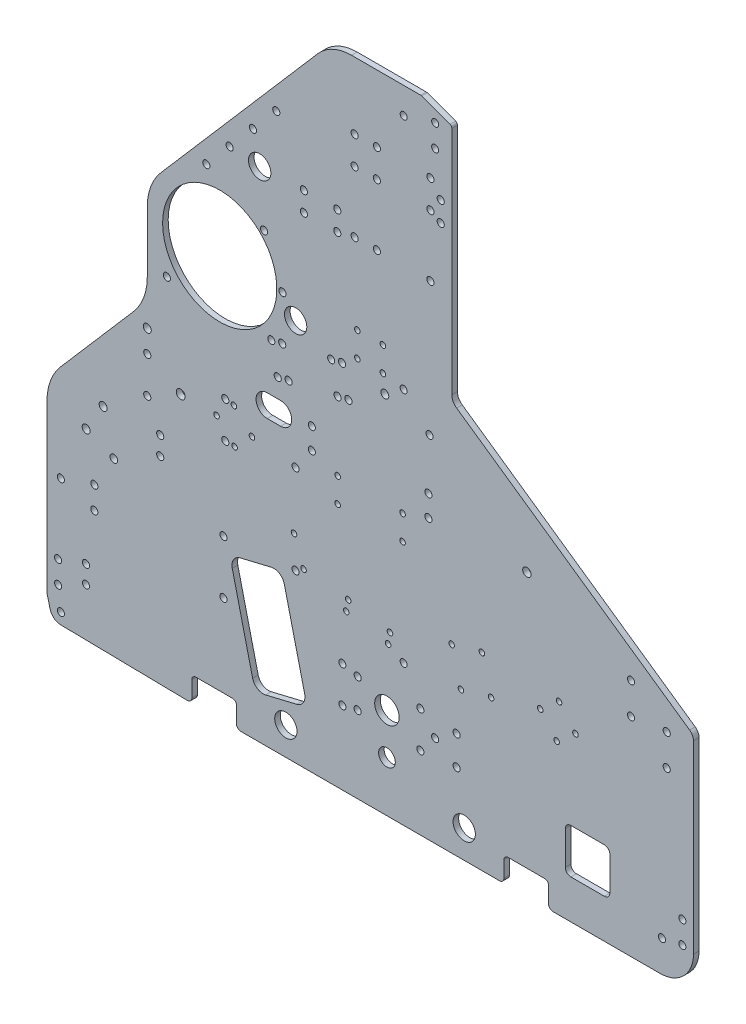
from build123d import *

# Parameters (mm, degrees)
SKETCH1_R           = 2.032
SKETCH1_R_2         = 2.54
SKETCH1_R_3         = 2
BOSS_EXTRUDE1_DEPTH = 3.175
FILLET1_R           = 2.286
FILLET2_R           = 6.35
SKETCH2_R           = 2.032
CUT_EXTRUDE1_DEPTH  = 505.524983177
FILLET3_R           = 1.5875
SKETCH3_R           = 6.35
SKETCH3_R_2         = 2.032
SKETCH3_R_3         = 2.286
CUT_EXTRUDE2_DEPTH  = 505.524983177
SKETCH4_R           = 2.032
SKETCH4_R_2         = 6.985
SKETCH4_R_3         = 4.7625
CUT_EXTRUDE3_DEPTH  = 505.524983177
SKETCH5_R           = 32.54375
SKETCH5_R_2         = 6.35
SKETCH5_R_3         = 2.39
CUT_EXTRUDE5_DEPTH  = 505.524983177
FILLET4_R           = 31.75
CUT_EXTRUDE6_DEPTH  = 505.524983177
FILLET5_R           = 25.4
SKETCH8_R           = 2.032000002
SKETCH8_R_2         = 2.031999999
SKETCH8_R_3         = 2.031999998
CUT_EXTRUDE7_DEPTH  = 505.524983177
SKETCH10_R          = 2.032000004
CUT_EXTRUDE8_DEPTH  = 505.524983177
SKETCH11_RX         = 2.032
SKETCH11_RY         = 2.031999502
CUT_EXTRUDE9_DEPTH  = 505.524983177
SKETCH12_R          = 2.032
CUT_EXTRUDE10_DEPTH = 505.524983319
SKETCH14_R          = 6.375981846
CUT_EXTRUDE11_DEPTH = 505.524983319
SKETCH15_R          = 2.286
SKETCH15_R_2        = 2.159
CUT_EXTRUDE12_DEPTH = 505.524983319
FILLET7_R           = 5.08
FILLET8_R           = 2.54
SKETCH17_R          = 2.032
CUT_EXTRUDE13_DEPTH = 505.524983319
FILLET9_R           = 19.05
SKETCH18_R          = 1.5875
CUT_EXTRUDE14_DEPTH = 505.524983319


with BuildPart() as part:
    # Sketch1 → Boss-Extrude1 (new body)
    with BuildSketch(Plane.XY):
        with BuildLine():
            Line((7.829508682, -19.049081656), (82.55, -20.32))
            Line((82.55, -20.32), (82.55, -6.35))
            Line((82.55, -6.35), (107.95, -6.35))
            Line((107.95, -6.35), (107.95, -20.32))
            Line((107.95, -20.32), (260.35, -20.32))
            Line((260.35, -20.32), (260.35, -6.35))
            Line((260.35, -6.35), (285.75, -6.35))
            Line((285.75, -6.35), (285.75, -20.32))
            Line((285.75, -20.32), (368.3, -20.32))
            Line((368.3, -20.32), (368.3, 106.68))
            Line((368.3, 106.68), (230.66375, 202.565))
            Line((230.66375, 202.565), (230.66375, 338.455))
            Line((230.66375, 338.455), (213.19998, 344.805))
            Line((213.19998, 344.805), (203.2, 344.805))
            Line((203.2, 344.805), (161.925, 344.805))
            Line((161.925, 344.805), (52.720122664, 218.469945827))
            ThreePointArc((52.720122664, 218.469945827), (52.803835479, 218.142145922), (52.832, 217.805))
            ThreePointArc((52.832, 217.805), (52.095493096, 216.239521914), (50.419872403, 215.808871996))
            Line((50.419872403, 215.808871996), (0, 157.48))
            Line((0, 157.48), (0, 0))
            Line((0, 0), (0, -6.35))
            ThreePointArc((0, -6.35), (0.047577015, -7.125863724), (0.189595124, -7.890101219))
            Line((0.189595124, -7.890101219), (1.777095124, -14.240101219))
            ThreePointArc((1.777095124, -14.240101219), (3.987212552, -17.671692778), (7.829508682, -19.049081656))
        make_face()
        with Locations((7.9375, -12.7)):
            Circle(SKETCH1_R, mode=Mode.SUBTRACT)
        with Locations((6.35, 0)):
            Circle(SKETCH1_R, mode=Mode.SUBTRACT)
        with Locations((6.35, 12.7)):
            Circle(SKETCH1_R, mode=Mode.SUBTRACT)
        with Locations((38.1, 78.105)):
            Circle(SKETCH1_R, mode=Mode.SUBTRACT)
        with Locations((57.15, 118.58625)):
            Circle(SKETCH1_R, mode=Mode.SUBTRACT)
        with Locations((57.15, 139.22375)):
            Circle(SKETCH1_R, mode=Mode.SUBTRACT)
        with Locations((76.2, 128.905)):
            Circle(SKETCH1_R_2, mode=Mode.SUBTRACT)
        with Locations((101.6, 118.58625)):
            Circle(SKETCH1_R, mode=Mode.SUBTRACT)
        with Locations((101.6, 139.22375)):
            Circle(SKETCH1_R, mode=Mode.SUBTRACT)
        with BuildLine():
            ThreePointArc((125.468192568, 141.56106164), (119.118192568, 147.91106164), (125.468192568, 154.26106164))
            Line((125.468192568, 154.26106164), (133.088192568, 154.26106164))
            ThreePointArc((133.088192568, 154.26106164), (139.438192568, 147.91106164), (133.088192568, 141.56106164))
            Line((133.088192568, 141.56106164), (125.468192568, 141.56106164))
        make_face(mode=Mode.SUBTRACT)
        with Locations((203.2, 59.805)):
            Circle(SKETCH1_R_3, mode=Mode.SUBTRACT)
        with Locations((350.339487758, -2.359487758)):
            Circle(SKETCH1_R, mode=Mode.SUBTRACT)
        with Locations((361.95, 0)):
            Circle(SKETCH1_R, mode=Mode.SUBTRACT)
        with Locations((361.95, 12.7)):
            Circle(SKETCH1_R, mode=Mode.SUBTRACT)
        with Locations((353.06, 82.955052336)):
            Circle(SKETCH1_R, mode=Mode.SUBTRACT)
        with Locations((332.74, 98.195052336)):
            Circle(SKETCH1_R, mode=Mode.SUBTRACT)
        with Locations((332.74, 115.975052336)):
            Circle(SKETCH1_R, mode=Mode.SUBTRACT)
        with Locations((353.06, 100.735052336)):
            Circle(SKETCH1_R, mode=Mode.SUBTRACT)
        with Locations((68.326, 182.923674932)):
            Circle(SKETCH1_R, mode=Mode.SUBTRACT)
        with Locations((76.2, 217.805)):
            Circle(SKETCH1_R, mode=Mode.SUBTRACT)
        with Locations((90.779500502, 249.682)):
            Circle(SKETCH1_R, mode=Mode.SUBTRACT)
        with Locations((104.067838673, 265.054783374)):
            Circle(SKETCH1_R, mode=Mode.SUBTRACT)
        with Locations((117.356176844, 280.427566748)):
            Circle(SKETCH1_R, mode=Mode.SUBTRACT)
        with Locations((130.644515014, 295.800350122)):
            Circle(SKETCH1_R, mode=Mode.SUBTRACT)
        with Locations((203.2, 194.805)):
            Circle(SKETCH1_R_3, mode=Mode.SUBTRACT)
        with Locations((224.31375, 287.401)):
            Circle(SKETCH1_R, mode=Mode.SUBTRACT)
        with Locations((224.31375, 298.831)):
            Circle(SKETCH1_R, mode=Mode.SUBTRACT)
        with Locations((203.2, 329.805)):
            Circle(SKETCH1_R_3, mode=Mode.SUBTRACT)
        with Locations((221.138115, 322.58)):
            Circle(SKETCH1_R_3, mode=Mode.SUBTRACT)
        with Locations((221.138115, 335.28)):
            Circle(SKETCH1_R_3, mode=Mode.SUBTRACT)
    extrude(amount=BOSS_EXTRUDE1_DEPTH)

    # Fillet1
    fillet1_edges = [part.edges().sort_by_distance(p)[0] for p in [
        (285.75, -6.35, 1.5875),
        (107.95, -6.35, 1.5875),
        (260.35, -6.35, 1.5875),
        (82.55, -6.35, 1.5875),
    ]]
    fillet(fillet1_edges, radius=FILLET1_R)

    # Fillet2
    fillet2_edges = [part.edges().sort_by_distance(p)[0] for p in [
        (230.66375, 202.565, 1.5875),
    ]]
    fillet(fillet2_edges, radius=FILLET2_R)

    # Sketch2 → Cut-Extrude1 (cut, through all)
    with BuildSketch(Plane(origin=(0, 0, 0), x_dir=(-1, 0, 0), z_dir=(0, 0, -1))):
        with Locations((-100.552770272, 71.086035298)):
            Circle(SKETCH2_R)
        with Locations((-100.552770272, 40.606035298)):
            Circle(SKETCH2_R)
        with Locations((-22.225, 18.202541089)):
            Circle(SKETCH2_R)
        with Locations((-22.225, 8.042541089)):
            Circle(SKETCH2_R)
    extrude(amount=-CUT_EXTRUDE1_DEPTH, mode=Mode.SUBTRACT)

    # Fillet3
    fillet3_edges = [part.edges().sort_by_distance(p)[0] for p in [
        (230.66375, 338.455, 1.5875),
        (213.19998, 344.805, 1.5875),
    ]]
    fillet(fillet3_edges, radius=FILLET3_R)

    # Sketch3 → Cut-Extrude2 (cut, through all)
    with BuildSketch(Plane.XY.offset(3.175)):
        with BuildLine():
            Line((127.789350211, 69.359774106), (110.090750339, 65.117184968))
            ThreePointArc((110.090750339, 65.117184968), (106.287939856, 62.356288953), (105.55119507, 57.715047577))
            Line((105.55119507, 57.715047577), (117.160037875, 9.287010566))
            ThreePointArc((117.160037875, 9.287010566), (119.92093389, 5.484200083), (124.562175266, 4.747455297))
            Line((124.562175266, 4.747455297), (142.260775137, 8.990044434))
            ThreePointArc((142.260775137, 8.990044434), (146.063585621, 11.75094045), (146.800330407, 16.392181825))
            Line((146.800330407, 16.392181825), (135.191487602, 64.820218836))
            ThreePointArc((135.191487602, 64.820218836), (132.430591586, 68.62302932), (127.789350211, 69.359774106))
        make_face()
        with Locations((136.094563167, -4.324155877)):
            Circle(SKETCH3_R)
        with Locations((237.694563167, -4.324155877)):
            Circle(SKETCH3_R)
        with Locations((26.987500002, 46.953113935)):
            Circle(SKETCH3_R_2)
        with Locations((26.987500002, 59.653113935)):
            Circle(SKETCH3_R_2)
        with Locations((7.937500002, 53.303113935)):
            Circle(SKETCH3_R_2)
        with Locations((32.030600949, 100.810868853)):
            Circle(SKETCH3_R_3)
        with Locations((64.525942114, 102.94048958)):
            Circle(SKETCH3_R_2)
        with Locations((64.525942114, 92.525786339)):
            Circle(SKETCH3_R_2)
        with Locations((134.14375, 208.228121768)):
            Circle(SKETCH3_R_2)
        with Locations((123.681970341, 233.485092108)):
            Circle(SKETCH3_R_2)
    extrude(amount=-CUT_EXTRUDE2_DEPTH, mode=Mode.SUBTRACT)

    # Sketch4 → Cut-Extrude3 (cut, through all)
    with BuildSketch(Plane.XY.offset(3.175)):
        with Locations((168.275, 42.06875)):
            Circle(SKETCH4_R)
        with Locations((212.725, 42.06875)):
            Circle(SKETCH4_R)
        with Locations((212.725, 21.43125)):
            Circle(SKETCH4_R)
        with Locations((168.275, 21.43125)):
            Circle(SKETCH4_R)
        with Locations((193.675, 31.75)):
            Circle(SKETCH4_R_2)
        with Locations((177.00498, 40.0431)):
            Circle(SKETCH4_R)
        with Locations((177.00498, 23.4569)):
            Circle(SKETCH4_R)
        with Locations((193.675, 8.466666658)):
            Circle(SKETCH4_R_3)
        with Locations((221.138115, 31.75)):
            Circle(SKETCH4_R)
        with Locations((233.36123, 23.4569)):
            Circle(SKETCH4_R)
        with Locations((233.36123, 40.0431)):
            Circle(SKETCH4_R)
    extrude(amount=-CUT_EXTRUDE3_DEPTH, mode=Mode.SUBTRACT)

    # Sketch5 → Cut-Extrude5 (cut, through all)
    with BuildSketch(Plane(origin=(0, 0, 0), x_dir=(-1, 0, 0), z_dir=(0, 0, -1))):
        Polygon((0, 157.48), (-57.15, 223.594705882), (-57.15, 165.333696112), (0, 99.218990229), align=None)
        with Locations((-98.425, 208.228121768)):
            Circle(SKETCH5_R)
        with Locations((-141.675587431, 197.971943782)):
            Circle(SKETCH5_R_2)
        with Locations((-273.4056, 139.72794)):
            Circle(SKETCH5_R_3)
    extrude(amount=-CUT_EXTRUDE5_DEPTH, mode=Mode.SUBTRACT)

    # Fillet4
    fillet4_edges = [part.edges().sort_by_distance(p)[0] for p in [
        (0, 99.218990229, 1.5875),
        (57.15, 165.333696112, 1.5875),
        (57.15, 223.594705882, 1.5875),
    ]]
    fillet(fillet4_edges, radius=FILLET4_R)

    # Sketch6 → Cut-Extrude6 (cut, through all)
    with BuildSketch(Plane.XY.offset(3.175)):
        with BuildLine():
            Line((298.45, 27.305), (317.5, 27.305))
            ThreePointArc((317.5, 27.305), (319.74506403, 26.37506403), (320.675, 24.13))
            Line((320.675, 24.13), (320.675, 5.08))
            ThreePointArc((320.675, 5.08), (319.74506403, 2.83493597), (317.5, 1.905))
            Line((317.5, 1.905), (298.45, 1.905))
            ThreePointArc((298.45, 1.905), (296.20493597, 2.83493597), (295.275, 5.08))
            Line((295.275, 5.08), (295.275, 24.13))
            ThreePointArc((295.275, 24.13), (296.20493597, 26.37506403), (298.45, 27.305))
        make_face()
    extrude(amount=-CUT_EXTRUDE6_DEPTH, mode=Mode.SUBTRACT)

    # Fillet5
    fillet5_edges = [part.edges().sort_by_distance(p)[0] for p in [
        (161.925, 344.805, 1.5875),
    ]]
    fillet(fillet5_edges, radius=FILLET5_R)

    # Sketch8 → Cut-Extrude7 (cut, through all)
    with BuildSketch(Plane(origin=(0, 0, 0), x_dir=(-1, 0, 0), z_dir=(0, 0, -1))):
        with Locations((-218.44, 290.83)):
            Circle(SKETCH8_R)
        with Locations((-187.96, 290.83)):
            Circle(SKETCH8_R)
        with Locations((-187.96, 306.70500001)):
            Circle(SKETCH8_R_2)
        with Locations((-175.26, 290.83)):
            Circle(SKETCH8_R)
        with Locations((-187.96, 255.905)):
            Circle(SKETCH8_R)
        with Locations((-218.44, 306.70500001)):
            Circle(SKETCH8_R_3)
        with Locations((-175.26, 306.70500001)):
            Circle(SKETCH8_R_2)
        with Locations((-175.26, 255.905)):
            Circle(SKETCH8_R)
        with Locations((-218.44, 255.905)):
            Circle(SKETCH8_R)
    extrude(amount=-CUT_EXTRUDE7_DEPTH, mode=Mode.SUBTRACT)

    # Sketch10 → Cut-Extrude8 (cut, through all)
    with BuildSketch(Plane.XY.offset(3.175)):
        with Locations((141.642479994, 74.684371768)):
            Circle(SKETCH10_R)
        with Locations((141.642479994, 125.484371768)):
            Circle(SKETCH10_R)
    extrude(amount=-CUT_EXTRUDE8_DEPTH, mode=Mode.SUBTRACT)

    # Sketch11 → Cut-Extrude9 (cut, through all)
    with BuildSketch(Plane.XY.offset(3.175)):
        with Locations(Location((150.881424454, 138.43), (0, 0, 90))):
            Ellipse(SKETCH11_RX, SKETCH11_RY)
        with Locations(Location((150.881424454, 150.495), (0, 0, 90))):
            Ellipse(SKETCH11_RX, SKETCH11_RY)
        with Locations(Location((217.30240818, 150.495), (0, 0, 90))):
            Ellipse(SKETCH11_RX, SKETCH11_RY)
        with Locations(Location((217.30240818, 138.43), (0, 0, 90))):
            Ellipse(SKETCH11_RX, SKETCH11_RY)
    extrude(amount=-CUT_EXTRUDE9_DEPTH, mode=Mode.SUBTRACT)

    # Sketch12 → Cut-Extrude10 (cut, through all)
    with BuildSketch(Plane(origin=(0, 0, 0), x_dir=(-1, 0, 0), z_dir=(0, 0, -1))):
        with Locations((-165.4175, 264.63498)):
            Circle(SKETCH12_R)
        with Locations((-165.4175, 253.52248)):
            Circle(SKETCH12_R)
        with Locations((-146.3675, 253.52248)):
            Circle(SKETCH12_R)
        with Locations((-146.3675, 264.63498)):
            Circle(SKETCH12_R)
    extrude(amount=-CUT_EXTRUDE10_DEPTH, mode=Mode.SUBTRACT)

    # Sketch14 → Cut-Extrude11 (cut, through all)
    with BuildSketch(Plane(origin=(0, 0, 0), x_dir=(-1, 0, 0), z_dir=(0, 0, -1))):
        with Locations((-121.184716432, 263.688494682)):
            Circle(SKETCH14_R)
    extrude(amount=-CUT_EXTRUDE11_DEPTH, mode=Mode.SUBTRACT)

    # Sketch15 → Cut-Extrude12 (cut, through all)
    with BuildSketch(Plane.XY.offset(3.175)):
        with Locations((57.149999979, 151.92375)):
            Circle(SKETCH15_R)
        with Locations((192.439038935, 187.119947783)):
            Circle(SKETCH15_R)
        with Locations((38.100000021, 78.105)):
            Circle(SKETCH15_R_2)
        with Locations((22.359447548, 84.872674248)):
            Circle(SKETCH15_R)
        with BuildLine():
            ThreePointArc((163.873739907, 173.680575348), (163.573171678, 172.102507308), (164.512499377, 170.799317578))
            ThreePointArc((164.512499377, 170.799317578), (167.54083865, 172.982117899), (163.873739907, 173.680575348))
        make_face()
        with BuildLine():
            ThreePointArc((173.439750066, 172.778441407), (173.740318296, 174.356509448), (172.800990596, 175.659699178))
            ThreePointArc((172.800990596, 175.659699178), (169.772651323, 173.476898857), (173.439750066, 172.778441407))
        make_face()
        with BuildLine():
            ThreePointArc((169.158852993, 192.088320238), (166.130513719, 189.905519916), (169.797612462, 189.207062467))
            ThreePointArc((169.797612462, 189.207062467), (170.098180692, 190.785130507), (169.158852993, 192.088320238))
        make_face()
        with BuildLine():
            ThreePointArc((160.231602304, 190.109196408), (159.931034074, 188.531128368), (160.870361773, 187.227938637))
            ThreePointArc((160.870361773, 187.227938637), (163.898701047, 189.410738959), (160.231602304, 190.109196408))
        make_face()
        with BuildLine():
            ThreePointArc((129.776601859, 166.121421831), (129.476033629, 164.543353791), (130.415361328, 163.240164061))
            ThreePointArc((130.415361328, 163.240164061), (133.443700602, 165.422964382), (129.776601859, 166.121421831))
        make_face()
        with BuildLine():
            ThreePointArc((139.342612017, 165.219287891), (139.643180247, 166.797355931), (138.703852548, 168.100545661))
            ThreePointArc((138.703852548, 168.100545661), (135.675513274, 165.91774534), (139.342612017, 165.219287891))
        make_face()
        with BuildLine():
            ThreePointArc((135.700474414, 181.64790895), (136.001042643, 183.225976991), (135.061714944, 184.529166721))
            ThreePointArc((135.061714944, 184.529166721), (132.033375671, 182.3463664), (135.700474414, 181.64790895))
        make_face()
        with BuildLine():
            ThreePointArc((126.134464255, 182.550042891), (125.833896025, 180.971974851), (126.773223725, 179.668785121))
            ThreePointArc((126.773223725, 179.668785121), (129.801562998, 181.851585442), (126.134464255, 182.550042891))
        make_face()
    extrude(amount=-CUT_EXTRUDE12_DEPTH, mode=Mode.SUBTRACT)

    # Fillet7
    fillet7_edges = [part.edges().sort_by_distance(p)[0] for p in [
        (368.3, 106.68, 1.5875),
    ]]
    fillet(fillet7_edges, radius=FILLET7_R)

    # Fillet8
    fillet8_edges = [part.edges().sort_by_distance(p)[0] for p in [
        (82.55, -20.32, 1.5875),
        (107.95, -20.32, 1.5875),
        (260.35, -20.32, 1.5875),
        (285.75, -20.32, 1.5875),
    ]]
    fillet(fillet8_edges, radius=FILLET8_R)

    # Sketch17 → Cut-Extrude13 (cut, through all)
    with BuildSketch(Plane.XY.offset(3.175)):
        with Locations((217.96375, 179.705)):
            Circle(SKETCH17_R)
    extrude(amount=-CUT_EXTRUDE13_DEPTH, mode=Mode.SUBTRACT)

    # Fillet9
    fillet9_edges = [part.edges().sort_by_distance(p)[0] for p in [
        (368.3, -20.32, 1.5875),
    ]]
    fillet(fillet9_edges, radius=FILLET9_R)

    # Sketch18 → Cut-Extrude14 (cut, through all)
    with BuildSketch(Plane.XY.offset(3.175)):
        with Locations((170.511046361, 68.966397639)):
            Circle(SKETCH18_R)
        with Locations((165.591916317, 119.38)):
            Circle(SKETCH18_R)
        with Locations((202.591916317, 119.38)):
            Circle(SKETCH18_R)
        with Locations((176.814816317, 210.82)):
            Circle(SKETCH18_R)
        with Locations((191.369016317, 210.82)):
            Circle(SKETCH18_R)
        with Locations((165.591916317, 133.35)):
            Circle(SKETCH18_R)
        with Locations((202.591916317, 133.35)):
            Circle(SKETCH18_R)
        with Locations((235.829835721, 63.104098689)):
            Circle(SKETCH18_R)
        with Locations((253.003996913, 67.705901311)):
            Circle(SKETCH18_R)
        with Locations((230.570632725, 82.731711479)):
            Circle(SKETCH18_R)
        with Locations((247.744793916, 87.333514101)):
            Circle(SKETCH18_R)
        with Locations((140.737131429, 92.548810178)):
            Circle(SKETCH18_R)
        with Locations((146.166701205, 77.631189823)):
            Circle(SKETCH18_R)
        with Locations((116.781916317, 128.27)):
            Circle(SKETCH18_R)
        with Locations((106.490542802, 138.561373515)):
            Circle(SKETCH18_R)
        with Locations((281.014286603, 76.059582017)):
            Circle(SKETCH18_R)
        with Locations((290.369546031, 64.910417983)):
            Circle(SKETCH18_R)
        with Locations((96.612261069, 128.683091782)):
            Circle(SKETCH18_R)
        with Locations((106.903634584, 118.391718267)):
            Circle(SKETCH18_R)
        with Locations((176.814816317, 196.85)):
            Circle(SKETCH18_R)
        with Locations((191.369016317, 196.85)):
            Circle(SKETCH18_R)
        with Locations((291.715927473, 85.039324924)):
            Circle(SKETCH18_R)
        with Locations((301.071186902, 73.89016089)):
            Circle(SKETCH18_R)
        with Locations((194.31, 64.77)):
            Circle(SKETCH18_R)
        with Locations((171.613712289, 75.219926871)):
            Circle(SKETCH18_R)
        with Locations((195.412665928, 71.023529232)):
            Circle(SKETCH18_R)
    extrude(amount=-CUT_EXTRUDE14_DEPTH, mode=Mode.SUBTRACT)


solid = part.part
